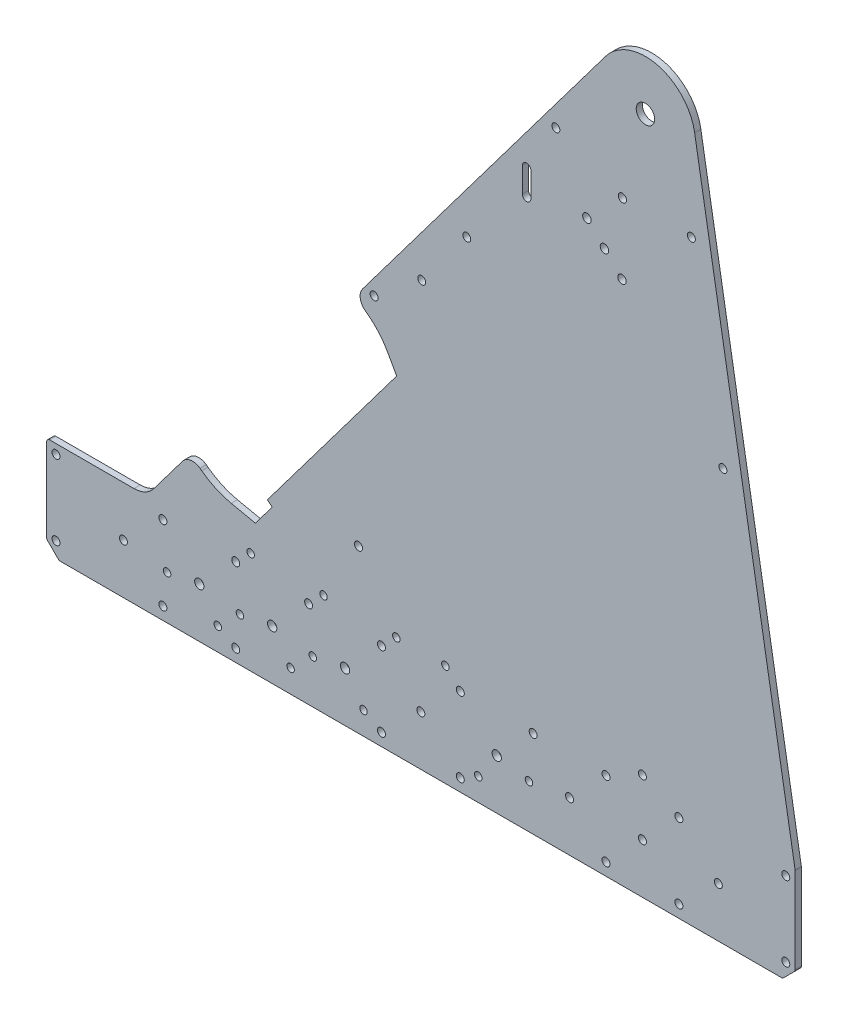
from build123d import *

# Parameters (mm, degrees)
BOSS_EXTRUDE1_DEPTH = 3.175
CUT_EXTRUDE1_REACH  = 534.132
SKETCH2_R           = 2.032
SKETCH5_R           = 2.032
SKETCH5_R_2         = 2.38125
CUT_EXTRUDE4_DEPTH  = 533.132273265
SKETCH6_R           = 2.032
CUT_EXTRUDE5_DEPTH  = 533.132273265
SKETCH3_R           = 4.699
SKETCH3_R_2         = 2.032
SKETCH3_R_3         = 2.0955
SKETCH3_R_4         = 2.159
CUT_EXTRUDE2_DEPTH  = 533.132273265
FILLET1_R           = 1.5875
CUT_EXTRUDE3_REACH  = 534.132
SKETCH4_R           = 1.905
FILLET2_R           = 38.1
FILLET3_R           = 6.35


with BuildPart() as part:
    # Sketch1 → Boss-Extrude1 (new body)
    with BuildSketch(Plane.XY):
        with BuildLine():
            Line((0, 0), (381, 0))
            Line((381, 0), (381, 50.8))
            Line((381, 50.8), (329.837432577, 350.351326687))
            ThreePointArc((329.837432577, 350.351326687), (310.787920632, 370.759100277), (284.504927721, 361.348180455))
            Line((284.504927721, 361.348180455), (157.027492501, 191.955579526))
            Line((157.027492501, 191.955579526), (169.711912675, 182.409841741))
            Line((169.711912675, 182.409841741), (178.167615548, 167.244965001))
            Line((178.167615548, 167.244965001), (112.326505112, 79.754995301))
            Line((112.326505112, 79.754995301), (114.863389147, 77.845847744))
            Line((114.863389147, 77.845847744), (106.272225141, 66.429869588))
            Line((106.272225141, 66.429869588), (85.709420174, 70.786944209))
            Line((85.709420174, 70.786944209), (73.025, 80.332681993))
            Line((73.025, 80.332681993), (54.610499914, 55.863409773))
            ThreePointArc((54.610499914, 55.863409773), (50.133294634, 52.136138511), (44.462963775, 50.8))
            Line((44.462963775, 50.8), (0, 50.8))
            Line((0, 50.8), (0, 0))
        make_face()
    extrude(amount=BOSS_EXTRUDE1_DEPTH)

    # Sketch2 → Cut-Extrude1 (cut, up to next)
    with BuildSketch(Plane.XY.offset(3.175), mode=Mode.PRIVATE) as cut_extrude1_sk1:
        with Locations((4.7625, 46.0375)):
            Circle(SKETCH2_R)
    cut_extrude1_tool1 = extrude(cut_extrude1_sk1.sketch, amount=-CUT_EXTRUDE1_REACH, mode=Mode.PRIVATE) & part.part
    # Sketch2 → Cut-Extrude1 (cut, up to next)
    with BuildSketch(Plane.XY.offset(3.175), mode=Mode.PRIVATE) as cut_extrude1_sk2:
        with Locations((4.7625, 7.9375)):
            Circle(SKETCH2_R)
    cut_extrude1_tool2 = extrude(cut_extrude1_sk2.sketch, amount=-CUT_EXTRUDE1_REACH, mode=Mode.PRIVATE) & part.part
    # Sketch2 → Cut-Extrude1 (cut, up to next)
    with BuildSketch(Plane.XY.offset(3.175), mode=Mode.PRIVATE) as cut_extrude1_sk3:
        with Locations((376.2375, 7.9375)):
            Circle(SKETCH2_R)
    cut_extrude1_tool3 = extrude(cut_extrude1_sk3.sketch, amount=-CUT_EXTRUDE1_REACH, mode=Mode.PRIVATE) & part.part
    # Sketch2 → Cut-Extrude1 (cut, up to next)
    with BuildSketch(Plane.XY.offset(3.175), mode=Mode.PRIVATE) as cut_extrude1_sk4:
        with Locations((376.2375, 46.0375)):
            Circle(SKETCH2_R)
    cut_extrude1_tool4 = extrude(cut_extrude1_sk4.sketch, amount=-CUT_EXTRUDE1_REACH, mode=Mode.PRIVATE) & part.part
    # Sketch2 → Cut-Extrude1 (cut, up to next)
    with BuildSketch(Plane.XY.offset(3.175), mode=Mode.PRIVATE) as cut_extrude1_sk5:
        Polygon((0, 6.35), (0, 0), (6.35, 0), align=None)
    cut_extrude1_tool5 = extrude(cut_extrude1_sk5.sketch, amount=-CUT_EXTRUDE1_REACH, mode=Mode.PRIVATE) & part.part
    # Sketch2 → Cut-Extrude1 (cut, up to next)
    with BuildSketch(Plane.XY.offset(3.175), mode=Mode.PRIVATE) as cut_extrude1_sk6:
        Polygon((381, 0), (374.65, 0), (381, 6.35), align=None)
    cut_extrude1_tool6 = extrude(cut_extrude1_sk6.sketch, amount=-CUT_EXTRUDE1_REACH, mode=Mode.PRIVATE) & part.part
    add(cut_extrude1_tool1.solids().sort_by_distance((4.7625, 46.0375, 3.175))[0], mode=Mode.SUBTRACT)
    add(cut_extrude1_tool2.solids().sort_by_distance((4.7625, 7.9375, 3.175))[0], mode=Mode.SUBTRACT)
    add(cut_extrude1_tool3.solids().sort_by_distance((376.2375, 7.9375, 3.175))[0], mode=Mode.SUBTRACT)
    add(cut_extrude1_tool4.solids().sort_by_distance((376.2375, 46.0375, 3.175))[0], mode=Mode.SUBTRACT)
    add(cut_extrude1_tool5.solids().sort_by_distance((2.116667, 2.116667, 3.175))[0], mode=Mode.SUBTRACT)
    add(cut_extrude1_tool6.solids().sort_by_distance((378.883333, 2.116667, 3.175))[0], mode=Mode.SUBTRACT)

    # Sketch5 → Cut-Extrude4 (cut, through all)
    with BuildSketch(Plane.XY.offset(3.175)):
        with Locations((39.116, 25.4)):
            Circle(SKETCH5_R)
        with Locations((59.182, 6.35)):
            Circle(SKETCH5_R)
        with Locations((59.182, 44.45)):
            Circle(SKETCH5_R)
        with Locations((96.266, 44.45)):
            Circle(SKETCH5_R)
        with Locations((133.35, 44.45)):
            Circle(SKETCH5_R)
        with Locations((170.434, 44.45)):
            Circle(SKETCH5_R)
        with Locations((210.566, 44.45)):
            Circle(SKETCH5_R)
        with Locations((210.566, 6.35)):
            Circle(SKETCH5_R)
        with Locations((170.434, 6.35)):
            Circle(SKETCH5_R)
        with Locations((247.65, 44.45)):
            Circle(SKETCH5_R)
        with Locations((266.192, 25.4)):
            Circle(SKETCH5_R)
        with Locations((77.724, 25.4)):
            Circle(SKETCH5_R_2)
        with Locations((114.808, 25.4)):
            Circle(SKETCH5_R_2)
        with Locations((151.892, 25.4)):
            Circle(SKETCH5_R_2)
        with Locations((229.108, 25.4)):
            Circle(SKETCH5_R_2)
        with Locations((190.5, 25.4)):
            Circle(SKETCH5_R)
        with Locations((303.276, 25.4)):
            Circle(SKETCH5_R)
        with Locations((341.884, 25.4)):
            Circle(SKETCH5_R)
    extrude(amount=-CUT_EXTRUDE4_DEPTH, mode=Mode.SUBTRACT)

    # Sketch6 → Cut-Extrude5 (cut, through all)
    with BuildSketch(Plane.XY.offset(3.175)):
        with Locations((284.734, 44.45)):
            Circle(SKETCH6_R)
        with Locations((284.734, 6.35)):
            Circle(SKETCH6_R)
        with Locations((321.818, 6.35)):
            Circle(SKETCH6_R)
        with Locations((321.818, 44.45)):
            Circle(SKETCH6_R)
        with Locations((96.266, 6.35)):
            Circle(SKETCH6_R)
        with Locations((303.276, 53.975)):
            Circle(SKETCH6_R)
    extrude(amount=-CUT_EXTRUDE5_DEPTH, mode=Mode.SUBTRACT)

    # Sketch3 → Cut-Extrude2 (cut, through all)
    with BuildSketch(Plane.XY.offset(3.175)):
        with Locations((304.8, 346.075)):
            Circle(SKETCH3_R)
        with Locations((166.6875, 196.85)):
            Circle(SKETCH3_R_2)
        with Locations((158.75, 82.55)):
            Circle(SKETCH3_R_2)
        with Locations((293.065185898, 303.201970739)):
            Circle(SKETCH3_R_3)
        with Locations((275.00852204, 285.338127639)):
            Circle(SKETCH3_R_4)
        with Locations((283.94044359, 276.30979571)):
            Circle(SKETCH3_R_4)
        with Locations((292.872365141, 267.281463781)):
            Circle(SKETCH3_R_4)
        with Locations((328.186766793, 303.440372165)):
            Circle(SKETCH3_R_2)
        with Locations((344.222991868, 209.55)):
            Circle(SKETCH3_R_2)
        with Locations((259.211844923, 317.178274551)):
            Circle(SKETCH3_R_2)
        with Locations((213.851281588, 246.342608418)):
            Circle(SKETCH3_R_2)
        with Locations((190.941510906, 215.9)):
            Circle(SKETCH3_R_2)
        with BuildLine():
            Line((242.153661094, 279.4), (242.153661094, 292.1))
            ThreePointArc((242.153661094, 292.1), (244.312661094, 294.259), (246.471661094, 292.1))
            Line((246.471661094, 292.1), (246.471661094, 279.4))
            ThreePointArc((246.471661094, 279.4), (244.312661094, 277.241), (242.153661094, 279.4))
        make_face()
    extrude(amount=-CUT_EXTRUDE2_DEPTH, mode=Mode.SUBTRACT)

    # Fillet1
    fillet1_edges = [part.edges().sort_by_distance(p)[0] for p in [
        (374.65, 0, 1.5875),
        (381, 6.35, 1.5875),
        (381, 50.8, 1.5875),
        (6.35, 0, 1.5875),
        (0, 6.35, 1.5875),
        (0, 50.8, 1.5875),
    ]]
    fillet(fillet1_edges, radius=FILLET1_R)

    # Sketch4 → Cut-Extrude3 (cut, up to next)
    with BuildSketch(Plane(origin=(0, 0, 0), x_dir=(-1, 0, 0), z_dir=(0, 0, -1)), mode=Mode.PRIVATE) as cut_extrude3_sk1:
        with Locations((-61.318145625, 22.298133105)):
            Circle(SKETCH4_R)
    cut_extrude3_tool1 = extrude(cut_extrude3_sk1.sketch, amount=-CUT_EXTRUDE3_REACH, mode=Mode.PRIVATE) & part.part
    # Sketch4 → Cut-Extrude3 (cut, up to next)
    with BuildSketch(Plane(origin=(0, 0, 0), x_dir=(-1, 0, 0), z_dir=(0, 0, -1)), mode=Mode.PRIVATE) as cut_extrude3_sk2:
        with Locations((-87.131339764, 11.605958005)):
            Circle(SKETCH4_R)
    cut_extrude3_tool2 = extrude(cut_extrude3_sk2.sketch, amount=-CUT_EXTRUDE3_REACH, mode=Mode.PRIVATE) & part.part
    # Sketch4 → Cut-Extrude3 (cut, up to next)
    with BuildSketch(Plane(origin=(0, 0, 0), x_dir=(-1, 0, 0), z_dir=(0, 0, -1)), mode=Mode.PRIVATE) as cut_extrude3_sk3:
        with Locations((-98.402145625, 22.298133105)):
            Circle(SKETCH4_R)
    cut_extrude3_tool3 = extrude(cut_extrude3_sk3.sketch, amount=-CUT_EXTRUDE3_REACH, mode=Mode.PRIVATE) & part.part
    # Sketch4 → Cut-Extrude3 (cut, up to next)
    with BuildSketch(Plane(origin=(0, 0, 0), x_dir=(-1, 0, 0), z_dir=(0, 0, -1)), mode=Mode.PRIVATE) as cut_extrude3_sk4:
        with Locations((-124.215339764, 11.605958005)):
            Circle(SKETCH4_R)
    cut_extrude3_tool4 = extrude(cut_extrude3_sk4.sketch, amount=-CUT_EXTRUDE3_REACH, mode=Mode.PRIVATE) & part.part
    # Sketch4 → Cut-Extrude3 (cut, up to next)
    with BuildSketch(Plane(origin=(0, 0, 0), x_dir=(-1, 0, 0), z_dir=(0, 0, -1)), mode=Mode.PRIVATE) as cut_extrude3_sk5:
        with Locations((-135.486145625, 22.298133105)):
            Circle(SKETCH4_R)
    cut_extrude3_tool5 = extrude(cut_extrude3_sk5.sketch, amount=-CUT_EXTRUDE3_REACH, mode=Mode.PRIVATE) & part.part
    # Sketch4 → Cut-Extrude3 (cut, up to next)
    with BuildSketch(Plane(origin=(0, 0, 0), x_dir=(-1, 0, 0), z_dir=(0, 0, -1)), mode=Mode.PRIVATE) as cut_extrude3_sk6:
        with Locations((-161.299339764, 11.605958005)):
            Circle(SKETCH4_R)
    cut_extrude3_tool6 = extrude(cut_extrude3_sk6.sketch, amount=-CUT_EXTRUDE3_REACH, mode=Mode.PRIVATE) & part.part
    # Sketch4 → Cut-Extrude3 (cut, up to next)
    with BuildSketch(Plane(origin=(0, 0, 0), x_dir=(-1, 0, 0), z_dir=(0, 0, -1)), mode=Mode.PRIVATE) as cut_extrude3_sk7:
        with Locations((-245.513854375, 22.298133105)):
            Circle(SKETCH4_R)
    cut_extrude3_tool7 = extrude(cut_extrude3_sk7.sketch, amount=-CUT_EXTRUDE3_REACH, mode=Mode.PRIVATE) & part.part
    # Sketch4 → Cut-Extrude3 (cut, up to next)
    with BuildSketch(Plane(origin=(0, 0, 0), x_dir=(-1, 0, 0), z_dir=(0, 0, -1)), mode=Mode.PRIVATE) as cut_extrude3_sk8:
        with Locations((-219.700660236, 11.605958005)):
            Circle(SKETCH4_R)
    cut_extrude3_tool8 = extrude(cut_extrude3_sk8.sketch, amount=-CUT_EXTRUDE3_REACH, mode=Mode.PRIVATE) & part.part
    # Sketch4 → Cut-Extrude3 (cut, up to next)
    with BuildSketch(Plane(origin=(0, 0, 0), x_dir=(-1, 0, 0), z_dir=(0, 0, -1)), mode=Mode.PRIVATE) as cut_extrude3_sk9:
        with Locations((-202.981986443, 51.968407021)):
            Circle(SKETCH4_R)
    cut_extrude3_tool9 = extrude(cut_extrude3_sk9.sketch, amount=-CUT_EXTRUDE3_REACH, mode=Mode.PRIVATE) & part.part
    # Sketch4 → Cut-Extrude3 (cut, up to next)
    with BuildSketch(Plane(origin=(0, 0, 0), x_dir=(-1, 0, 0), z_dir=(0, 0, -1)), mode=Mode.PRIVATE) as cut_extrude3_sk10:
        with Locations((-178.018013557, 51.968407021)):
            Circle(SKETCH4_R)
    cut_extrude3_tool10 = extrude(cut_extrude3_sk10.sketch, amount=-CUT_EXTRUDE3_REACH, mode=Mode.PRIVATE) & part.part
    # Sketch4 → Cut-Extrude3 (cut, up to next)
    with BuildSketch(Plane(origin=(0, 0, 0), x_dir=(-1, 0, 0), z_dir=(0, 0, -1)), mode=Mode.PRIVATE) as cut_extrude3_sk11:
        with Locations((-140.934013557, 51.968407021)):
            Circle(SKETCH4_R)
    cut_extrude3_tool11 = extrude(cut_extrude3_sk11.sketch, amount=-CUT_EXTRUDE3_REACH, mode=Mode.PRIVATE) & part.part
    # Sketch4 → Cut-Extrude3 (cut, up to next)
    with BuildSketch(Plane(origin=(0, 0, 0), x_dir=(-1, 0, 0), z_dir=(0, 0, -1)), mode=Mode.PRIVATE) as cut_extrude3_sk12:
        with Locations((-103.850013557, 51.968407021)):
            Circle(SKETCH4_R)
    cut_extrude3_tool12 = extrude(cut_extrude3_sk12.sketch, amount=-CUT_EXTRUDE3_REACH, mode=Mode.PRIVATE) & part.part
    add(cut_extrude3_tool1.solids().sort_by_distance((61.318146, 22.298133, 0))[0], mode=Mode.SUBTRACT)
    add(cut_extrude3_tool2.solids().sort_by_distance((87.13134, 11.605958, 0))[0], mode=Mode.SUBTRACT)
    add(cut_extrude3_tool3.solids().sort_by_distance((98.402146, 22.298133, 0))[0], mode=Mode.SUBTRACT)
    add(cut_extrude3_tool4.solids().sort_by_distance((124.21534, 11.605958, 0))[0], mode=Mode.SUBTRACT)
    add(cut_extrude3_tool5.solids().sort_by_distance((135.486146, 22.298133, 0))[0], mode=Mode.SUBTRACT)
    add(cut_extrude3_tool6.solids().sort_by_distance((161.29934, 11.605958, 0))[0], mode=Mode.SUBTRACT)
    add(cut_extrude3_tool7.solids().sort_by_distance((245.513854, 22.298133, 0))[0], mode=Mode.SUBTRACT)
    add(cut_extrude3_tool8.solids().sort_by_distance((219.70066, 11.605958, 0))[0], mode=Mode.SUBTRACT)
    add(cut_extrude3_tool9.solids().sort_by_distance((202.981986, 51.968407, 0))[0], mode=Mode.SUBTRACT)
    add(cut_extrude3_tool10.solids().sort_by_distance((178.018014, 51.968407, 0))[0], mode=Mode.SUBTRACT)
    add(cut_extrude3_tool11.solids().sort_by_distance((140.934014, 51.968407, 0))[0], mode=Mode.SUBTRACT)
    add(cut_extrude3_tool12.solids().sort_by_distance((103.850014, 51.968407, 0))[0], mode=Mode.SUBTRACT)

    # Fillet2
    fillet2_edges = [part.edges().sort_by_distance(p)[0] for p in [
        (85.709420174, 70.786944209, 1.5875),
        (169.711912675, 182.409841741, 1.5875),
    ]]
    fillet(fillet2_edges, radius=FILLET2_R)

    # Fillet3
    fillet3_edges = [part.edges().sort_by_distance(p)[0] for p in [
        (73.025, 80.332681993, 1.5875),
        (157.027492501, 191.955579526, 1.5875),
    ]]
    fillet(fillet3_edges, radius=FILLET3_R)


solid = part.part
